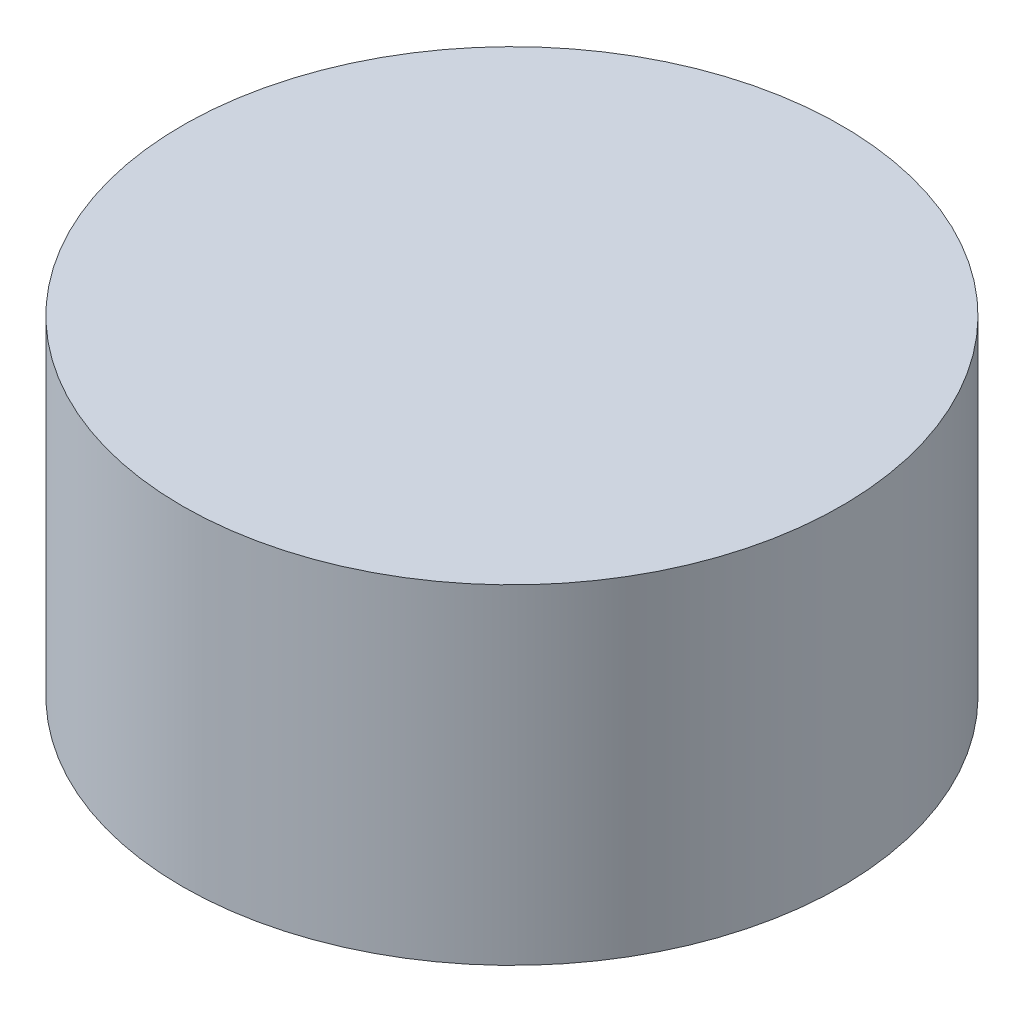
from build123d import *

# Parameters (mm, degrees)
SKETCH1_R           = 50
BOSS_EXTRUDE1_DEPTH = 50


with BuildPart() as part:
    # Sketch1 → Boss-Extrude1 (new body)
    with BuildSketch(Plane(origin=(0, 0, 0), x_dir=(1, 0, 0), z_dir=(0, 1, 0))):
        Circle(SKETCH1_R)
    extrude(amount=BOSS_EXTRUDE1_DEPTH)


solid = part.part
